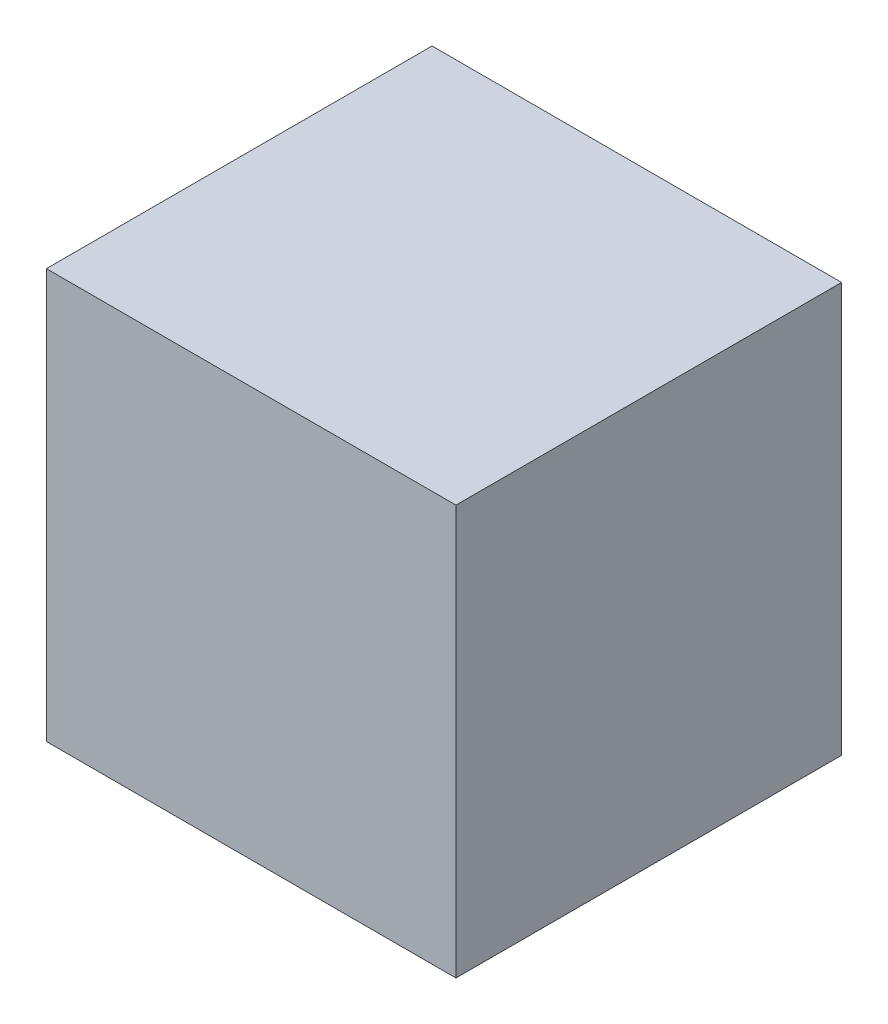
from build123d import *

# Parameters (mm, degrees)
SCHIZZO1_W                   = 100
SCHIZZO1_H                   = 100
ESTRUSIONE_ESTRUSIONE1_DEPTH = 94.16


with BuildPart() as part:
    # Schizzo1 → Estrusione-Estrusione1 (new body)
    with BuildSketch(Plane.XY):
        Rectangle(SCHIZZO1_W, SCHIZZO1_H)
    extrude(amount=ESTRUSIONE_ESTRUSIONE1_DEPTH)


solid = part.part
